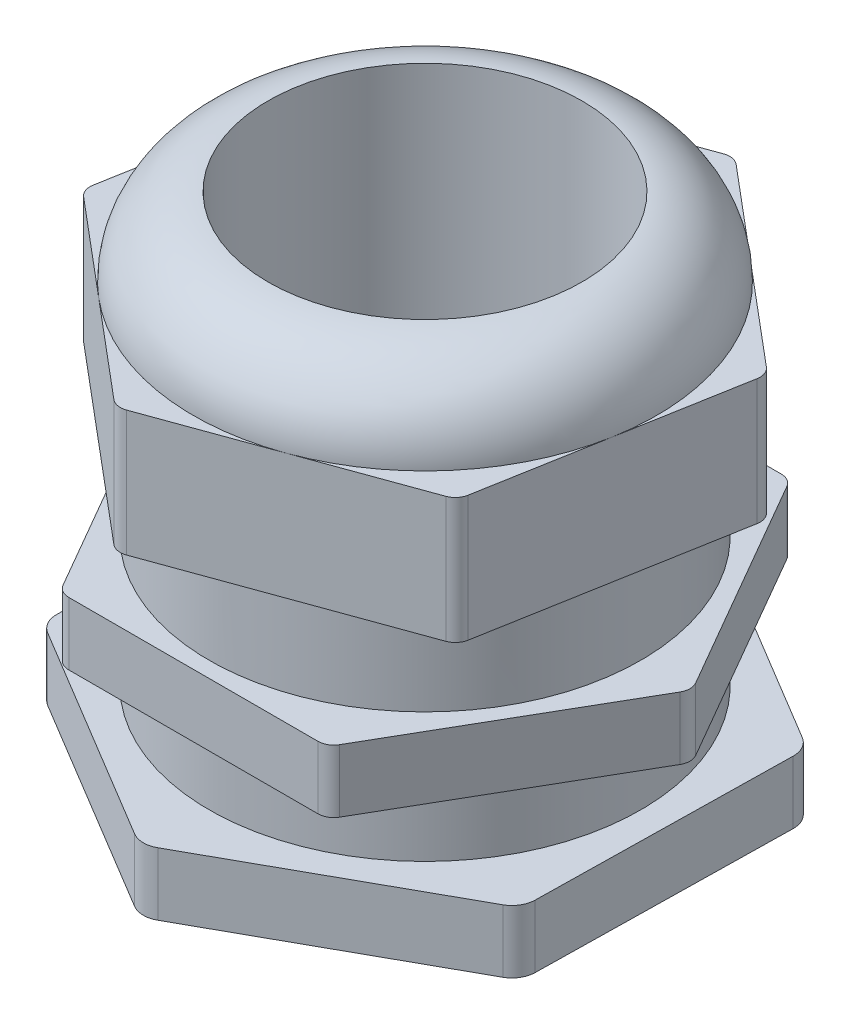
from build123d import *

# Parameters (mm, degrees)
EXTRUDE_1_DEPTH     = 8
SKETCH_2_R          = 27.5
EXTRUDE_2_DEPTH     = 12
EXTRUDE_3_DEPTH     = 16
SKETCH_4_R          = 29.5
EXTRUDE_4_DEPTH     = 10
FILLET_1_R          = 10
EXTRUDE_START       = 8.5
SKETCH_5_R          = 27.5
EXTRUDE_5_DEPTH     = 8.5
EXTRUDE_6_DEPTH     = 8
SKETCH_7_R          = 20
CUT_EXTRUDE_1_DEPTH = 80.671476808
FILLET_2_R          = 2
FILLET_3_R          = 2
FILLET_4_R          = 3


with BuildPart() as part:
    # Эскиз1 → Вытянуть1 (new body)
    with BuildSketch(Plane(origin=(0, 0, 0), x_dir=(1, 0, 0), z_dir=(0, 1, 0))):
        Polygon((34.063665882, 0), (17.031832941, 29.5), (-17.031832941, 29.5), (-34.063665882, 0), (-17.031832941, -29.5), (17.031832941, -29.5), align=None)
    extrude(amount=EXTRUDE_1_DEPTH)

    # Эскиз2 → Вытянуть2 (add)
    with BuildSketch(Plane(origin=(0, 8, 0), x_dir=(1, 0, 0), z_dir=(0, 1, 0))):
        with Locations(Location((0, 0, 0), (0, 0, 90))):
            Circle(SKETCH_2_R)
    extrude(amount=EXTRUDE_2_DEPTH)

    # Эскиз3 → Вытянуть3 (add)
    with BuildSketch(Plane(origin=(0, 20, 0), x_dir=(1, 0, 0), z_dir=(0, 1, 0))):
        Polygon((5.957184122, 33.538713313), (-26.066785678, 21.928429441), (-32.0239698, -11.610283872), (-5.957184122, -33.538713313), (26.066785678, -21.928429441), (32.0239698, 11.610283872), align=None)
    extrude(amount=EXTRUDE_3_DEPTH)

    # Эскиз4 → Вытянуть4 (add)
    with BuildSketch(Plane(origin=(0, 36, 0), x_dir=(1, 0, 0), z_dir=(0, 1, 0))):
        with Locations(Location((0, 0, 0), (0, 0, 109.92810259))):
            Circle(SKETCH_4_R)
    extrude(amount=EXTRUDE_4_DEPTH)

    # Скругление1
    fillet_1_edges = [part.edges().sort_by_distance(p)[0] for p in [
        (10.054800778, 46, 27.733571377),
    ]]
    fillet(fillet_1_edges, radius=FILLET_1_R - 0.0001)  # a hair under: the kernel refuses the full size

    # Эскиз5 → Вытянуть5 (add)
    with BuildSketch(Plane.XZ.offset(EXTRUDE_START)):
        with Locations(Location((0, 0, 0), (0, 0, 270))):
            Circle(SKETCH_5_R)
    extrude(amount=-EXTRUDE_5_DEPTH)

    # Эскиз6 → Вытянуть6 (add)
    with BuildSketch(Plane.XZ.offset(8.5)):
        Polygon((30.690350843, 18.423780786), (-0.610286773, 35.790513874), (-31.300637616, 17.366733088), (-30.690350843, -18.423780786), (0.610286773, -35.790513874), (31.300637616, -17.366733088), align=None)
    extrude(amount=EXTRUDE_6_DEPTH)

    # Эскиз7 → Вырез-Вытянуть1 (cut, through all)
    with BuildSketch(Plane(origin=(0, 46, 0), x_dir=(1, 0, 0), z_dir=(0, 1, 0))):
        with Locations(Location((0, 0, 0), (0, 0, 270))):
            Circle(SKETCH_7_R)
    extrude(amount=-CUT_EXTRUDE_1_DEPTH, mode=Mode.SUBTRACT)

    # Скругление2
    fillet_2_edges = [part.edges().sort_by_distance(p)[0] for p in [
        (32.0239698, 28, -11.610283872),
        (5.957184122, 28, -33.538713313),
        (-26.066785678, 28, -21.928429441),
        (-32.0239698, 28, 11.610283872),
        (-5.957184122, 28, 33.538713313),
        (26.066785678, 28, 21.928429441),
    ]]
    fillet(fillet_2_edges, radius=FILLET_2_R)

    # Скругление3
    fillet_3_edges = [part.edges().sort_by_distance(p)[0] for p in [
        (17.031832941, 4, 29.5),
        (-17.031832941, 4, 29.5),
        (-34.063665882, 4, 0),
        (-17.031832941, 4, -29.5),
        (17.031832941, 4, -29.5),
        (34.063665882, 4, 0),
    ]]
    fillet(fillet_3_edges, radius=FILLET_3_R)

    # Скругление4
    fillet_4_edges = [part.edges().sort_by_distance(p)[0] for p in [
        (31.300637616, -12.5, -17.366733088),
        (30.690350843, -12.5, 18.423780786),
        (-0.610286773, -12.5, 35.790513874),
        (-31.300637616, -12.5, 17.366733088),
        (-30.690350843, -12.5, -18.423780786),
        (0.610286773, -12.5, -35.790513874),
    ]]
    fillet(fillet_4_edges, radius=FILLET_4_R)


solid = part.part
